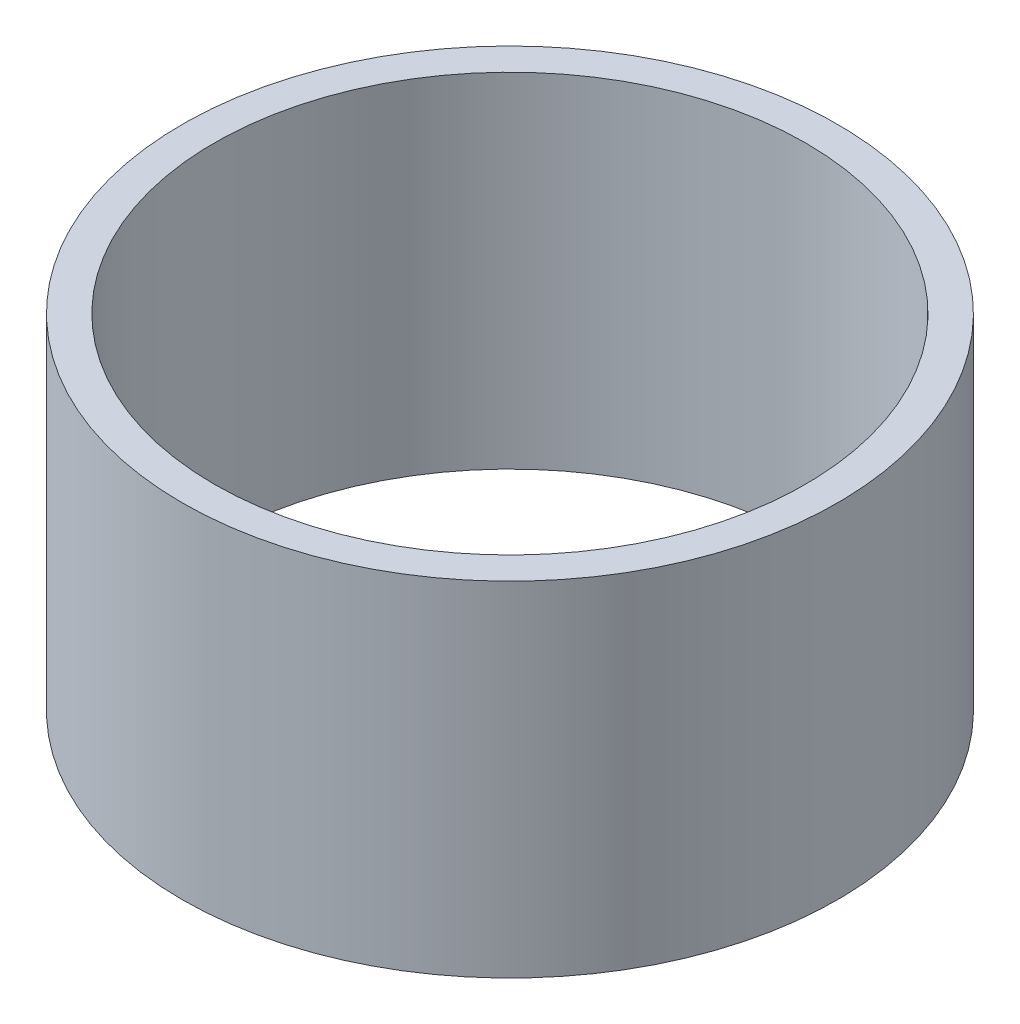
from build123d import *

# Parameters (mm, degrees)
SKETCH1_R           = 47.5
BOSS_EXTRUDE1_DEPTH = 49.813097527
SKETCH2_R           = 42.848303673
CUT_EXTRUDE1_DEPTH  = 84.629209522


with BuildPart() as part:
    # Sketch1 → Boss-Extrude1 (new body)
    with BuildSketch(Plane(origin=(0, 0, 0), x_dir=(1, 0, 0), z_dir=(0, 1, 0))):
        Circle(SKETCH1_R)
    extrude(amount=BOSS_EXTRUDE1_DEPTH)

    # Sketch2 → Cut-Extrude1 (cut, through all)
    with BuildSketch(Plane(origin=(0, 0, 0), x_dir=(1, 0, 0), z_dir=(0, 1, 0))):
        Circle(SKETCH2_R)
    extrude(amount=CUT_EXTRUDE1_DEPTH, mode=Mode.SUBTRACT)


solid = part.part
